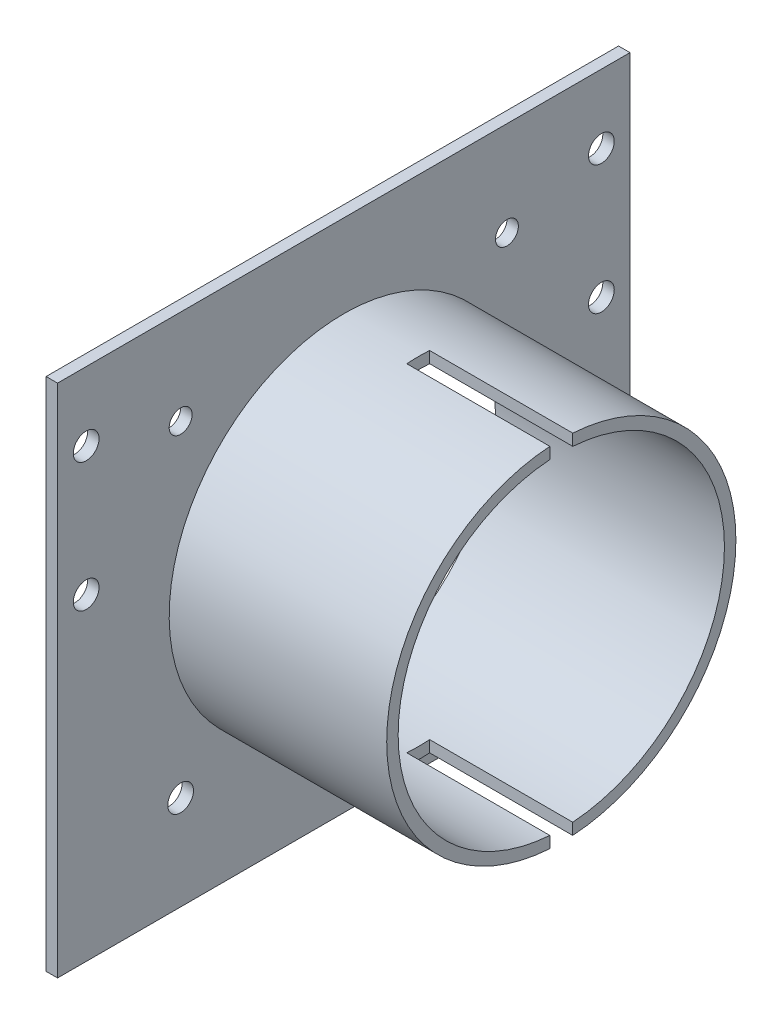
from build123d import *

# Parameters (mm, degrees)
CROQUIS1_W                       = 200
CROQUIS1_H                       = 180
CROQUIS1_R                       = 57
CROQUIS1_R_2                     = 4
SALIENTE_EXTRUIR1_DEPTH          = 4
CROQUIS2_R                       = 61
CROQUIS2_R_2                     = 57
SALIENTE_EXTRUIR2_DEPTH          = 76
CROQUIS3_W                       = 8
CROQUIS3_H                       = 23.163617774
CORTAR_EXTRUIR1_DEPTH            = 50
TALADRO_DE_MARGEN_PARA_M81_D     = 9
TALADRO_DE_MARGEN_PARA_M81_DEPTH = 4.999


with BuildPart() as part:
    # Croquis1 → Saliente-Extruir1 (new body)
    with BuildSketch(Plane(origin=(0, 0, 0), x_dir=(0, 0, -1), z_dir=(1, 0, 0))):
        Rectangle(CROQUIS1_W, CROQUIS1_H)
        Circle(CROQUIS1_R, mode=Mode.SUBTRACT)
        with Locations((-57, 57)):
            Circle(CROQUIS1_R_2, mode=Mode.SUBTRACT)
        with Locations((57, 57)):
            Circle(CROQUIS1_R_2, mode=Mode.SUBTRACT)
        with Locations((57, -57)):
            Circle(CROQUIS1_R_2, mode=Mode.SUBTRACT)
        with Locations((-57, -57)):
            Circle(CROQUIS1_R_2, mode=Mode.SUBTRACT)
    extrude(amount=SALIENTE_EXTRUIR1_DEPTH)

    # Croquis2 → Saliente-Extruir2 (add)
    with BuildSketch(Plane(origin=(4, 0, 0), x_dir=(0, 0, -1), z_dir=(1, 0, 0))):
        Circle(CROQUIS2_R)
        Circle(CROQUIS2_R_2, mode=Mode.SUBTRACT)
    extrude(amount=SALIENTE_EXTRUIR2_DEPTH)

    # Croquis3 → Cortar-Extruir1 (cut)
    with BuildSketch(Plane(origin=(80, 0, 0), x_dir=(0, 0, -1), z_dir=(1, 0, 0))):
        with Locations((0, 57)):
            Rectangle(CROQUIS3_W, CROQUIS3_H)
        with Locations((0, -57)):
            Rectangle(CROQUIS3_W, CROQUIS3_H)
    extrude(amount=-CORTAR_EXTRUIR1_DEPTH, mode=Mode.SUBTRACT)

    # Taladro de margen para M81
    with Locations(Plane(origin=(4, -7.41730184, -252.760845032), x_dir=(0, 0, -1), z_dir=(1, 0, 0))):
        with Locations((-342.760845032, 73.414694032), (-342.760845032, 28.414694032), (-162.760845032, 73.414694032), (-162.760845032, 28.414694032), (-195.760845032, -49.58269816), (-309.760845032, -49.58269816)):
            Hole(TALADRO_DE_MARGEN_PARA_M81_D / 2, depth=TALADRO_DE_MARGEN_PARA_M81_DEPTH)


solid = part.part
